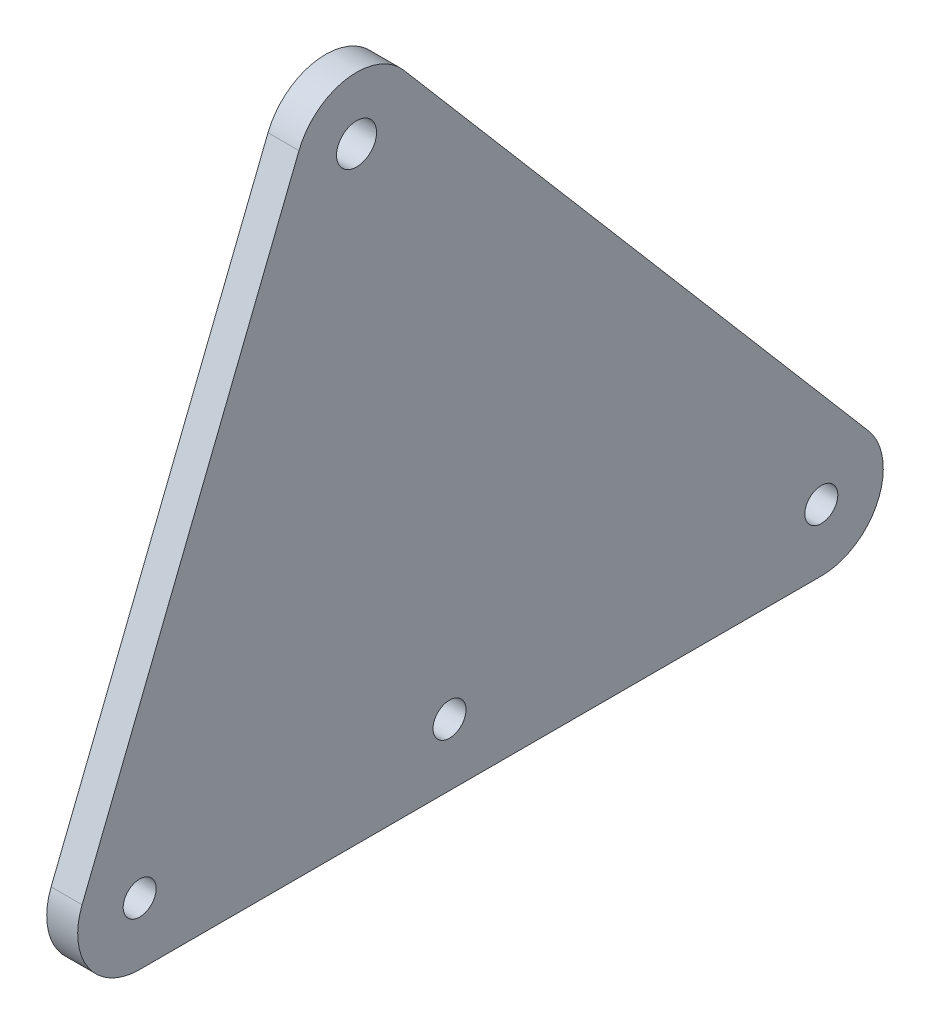
from build123d import *

# Parameters (mm, degrees)
BOSS_EXTRUDE1_DEPTH = 6.35
CUT_EXTRUDE1_REACH  = 166.779
SKETCH2_R           = 3.3782
SKETCH2_R_2         = 4.1021


with BuildPart() as part:
    # Sketch1 → Boss-Extrude1 (new body)
    with BuildSketch(Plane(origin=(0, 0, 0), x_dir=(0, 0, -1), z_dir=(1, 0, 0))):
        with BuildLine():
            Line((-56.249045375, -106.934859066), (-11.799045375, 4.698140934))
            ThreePointArc((-11.799045375, 4.698140934), (-2.069950001, 12.530175856), (9.661154553, 8.243305933))
            Line((9.661154553, 8.243305933), (104.911154553, -103.389694067))
            ThreePointArc((104.911154553, -103.389694067), (106.782128714, -116.95277512), (95.25, -124.333))
            Line((95.25, -124.333), (-44.45, -124.333))
            ThreePointArc((-44.45, -124.333), (-54.960860808, -118.76123997), (-56.249045375, -106.934859066))
        make_face()
    extrude(amount=BOSS_EXTRUDE1_DEPTH)

    # Sketch2 → Cut-Extrude1 (cut, up to next)
    with BuildSketch(Plane(origin=(6.35, 0, 0), x_dir=(0, 0, -1), z_dir=(1, 0, 0)), mode=Mode.PRIVATE) as cut_extrude1_sk1:
        with Locations((-44.45, -111.633)):
            Circle(SKETCH2_R)
    cut_extrude1_tool1 = extrude(cut_extrude1_sk1.sketch, amount=-CUT_EXTRUDE1_REACH, mode=Mode.PRIVATE) & part.part
    # Sketch2 → Cut-Extrude1 (cut, up to next)
    with BuildSketch(Plane(origin=(6.35, 0, 0), x_dir=(0, 0, -1), z_dir=(1, 0, 0)), mode=Mode.PRIVATE) as cut_extrude1_sk2:
        with Locations((19.05, -111.633)):
            Circle(SKETCH2_R)
    cut_extrude1_tool2 = extrude(cut_extrude1_sk2.sketch, amount=-CUT_EXTRUDE1_REACH, mode=Mode.PRIVATE) & part.part
    # Sketch2 → Cut-Extrude1 (cut, up to next)
    with BuildSketch(Plane(origin=(6.35, 0, 0), x_dir=(0, 0, -1), z_dir=(1, 0, 0)), mode=Mode.PRIVATE) as cut_extrude1_sk3:
        with Locations((95.25, -111.633)):
            Circle(SKETCH2_R)
    cut_extrude1_tool3 = extrude(cut_extrude1_sk3.sketch, amount=-CUT_EXTRUDE1_REACH, mode=Mode.PRIVATE) & part.part
    # Sketch2 → Cut-Extrude1 (cut, up to next)
    with BuildSketch(Plane(origin=(6.35, 0, 0), x_dir=(0, 0, -1), z_dir=(1, 0, 0)), mode=Mode.PRIVATE) as cut_extrude1_sk4:
        Circle(SKETCH2_R_2)
    cut_extrude1_tool4 = extrude(cut_extrude1_sk4.sketch, amount=-CUT_EXTRUDE1_REACH, mode=Mode.PRIVATE) & part.part
    add(cut_extrude1_tool1.solids().sort_by_distance((6.35, -111.633, 44.45))[0], mode=Mode.SUBTRACT)
    add(cut_extrude1_tool2.solids().sort_by_distance((6.35, -111.633, -19.05))[0], mode=Mode.SUBTRACT)
    add(cut_extrude1_tool3.solids().sort_by_distance((6.35, -111.633, -95.25))[0], mode=Mode.SUBTRACT)
    add(cut_extrude1_tool4.solids().sort_by_distance((6.35, 0, 0))[0], mode=Mode.SUBTRACT)


solid = part.part
